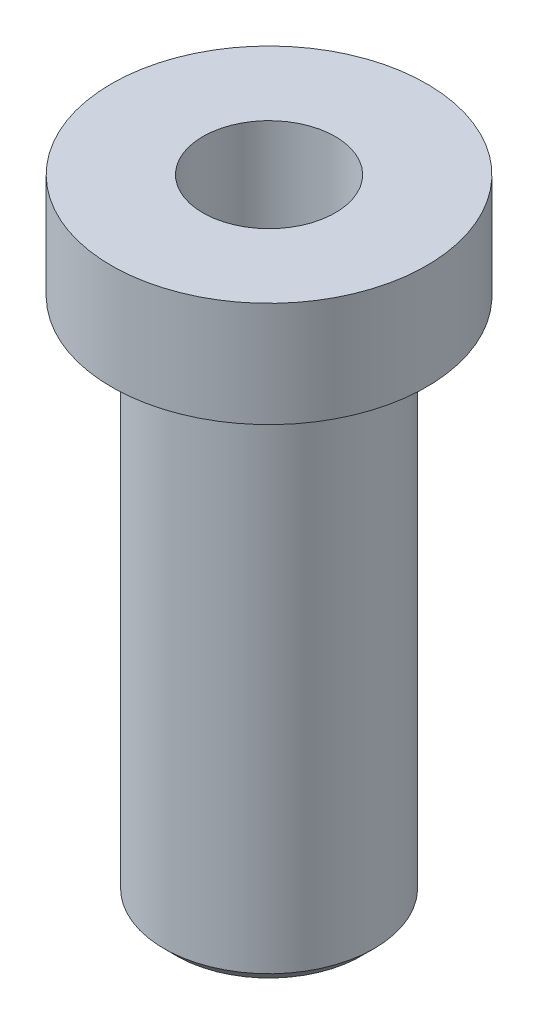
from build123d import *

# Parameters (mm, degrees)
CHAMFER1_SIZE = 1.524


with BuildPart() as part:
    # Sketch1 → Revolve2 (revolve)
    with BuildSketch(Plane.XY):
        Polygon((12.7, -38.1), (12.7, 25.4), (19.05, 25.4), (19.05, 38.1), (8.001, 38.1), (8.001, -38.1), align=None)
    revolve(axis=Axis((0, 38.1, 0), (0, -1, 0)))

    # Chamfer1
    chamfer1_edges = [part.edges().sort_by_distance(p)[0] for p in [
        (-12.7, -38.1, 0),
    ]]
    chamfer(chamfer1_edges, length=CHAMFER1_SIZE)


solid = part.part
